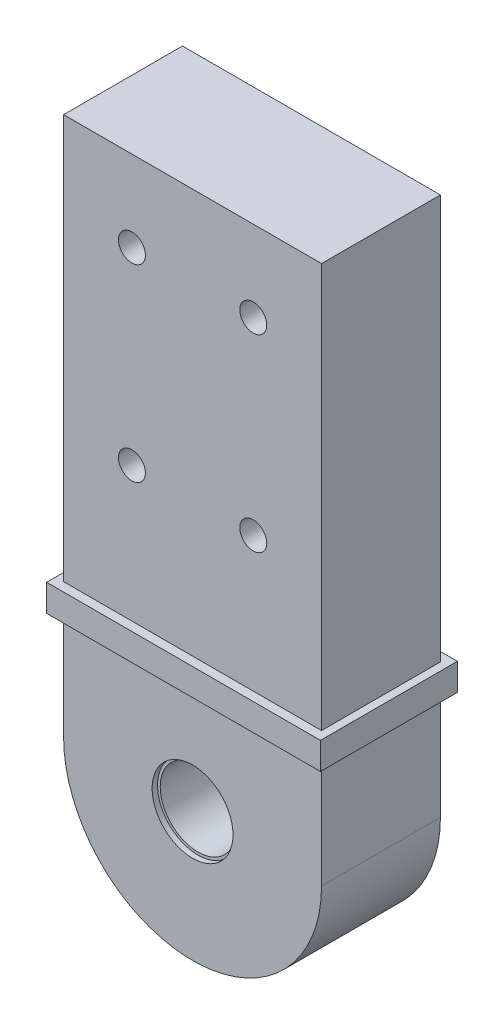
from build123d import *

# Parameters (mm, degrees)
SKETCH1_R           = 7
SKETCH1_R_2         = 2.5
BOSS_EXTRUDE1_DEPTH = 22.05
SKETCH2_R           = 7.5
CUT_EXTRUDE1_DEPTH  = 1
CUT_EXTRUDE2_START  = -1
SKETCH3_R           = 7.5
CUT_EXTRUDE2_DEPTH  = 1
SKETCH5_W           = 50.8
SKETCH5_H           = 25.4
SKETCH5_W_2         = 47.85
SKETCH5_H_2         = 22.05
BOSS_EXTRUDE2_DEPTH = 5


with BuildPart() as part:
    # Sketch1 → Boss-Extrude1 (new body)
    with BuildSketch(Plane.XY):
        with BuildLine():
            Line((-23.925, 0), (-23.925, 100))
            Line((-23.925, 100), (23.925, 100))
            Line((23.925, 100), (23.925, 0))
            ThreePointArc((23.925, 0), (0, -23.925), (-23.925, 0))
        make_face()
        Circle(SKETCH1_R, mode=Mode.SUBTRACT)
        with Locations((-11.25, 85)):
            Circle(SKETCH1_R_2, mode=Mode.SUBTRACT)
        with Locations((11.25, 85)):
            Circle(SKETCH1_R_2, mode=Mode.SUBTRACT)
        with Locations((11.25, 50)):
            Circle(SKETCH1_R_2, mode=Mode.SUBTRACT)
        with Locations((-11.25, 50)):
            Circle(SKETCH1_R_2, mode=Mode.SUBTRACT)
    extrude(amount=BOSS_EXTRUDE1_DEPTH)

    # Sketch2 → Cut-Extrude1 (cut)
    with BuildSketch(Plane.XY.offset(22.05)):
        Circle(SKETCH2_R)
    extrude(amount=-CUT_EXTRUDE1_DEPTH, mode=Mode.SUBTRACT)

    # Sketch3 → Cut-Extrude2 (cut)
    with BuildSketch(Plane(origin=(0, 0, 0), x_dir=(-1, 0, 0), z_dir=(0, 0, -1)).offset(CUT_EXTRUDE2_START)):
        Circle(SKETCH3_R)
    extrude(amount=CUT_EXTRUDE2_DEPTH, mode=Mode.SUBTRACT)

    # Sketch5 → Boss-Extrude2 (add)
    with BuildSketch(Plane(origin=(0, 24.981, 0), x_dir=(1, 0, 0), z_dir=(0, 1, 0))):
        with Locations((0, -11.025)):
            Rectangle(SKETCH5_W, SKETCH5_H)
        with Locations((0, -11.025)):
            Rectangle(SKETCH5_W_2, SKETCH5_H_2, mode=Mode.SUBTRACT)
    extrude(amount=-BOSS_EXTRUDE2_DEPTH)


solid = part.part
